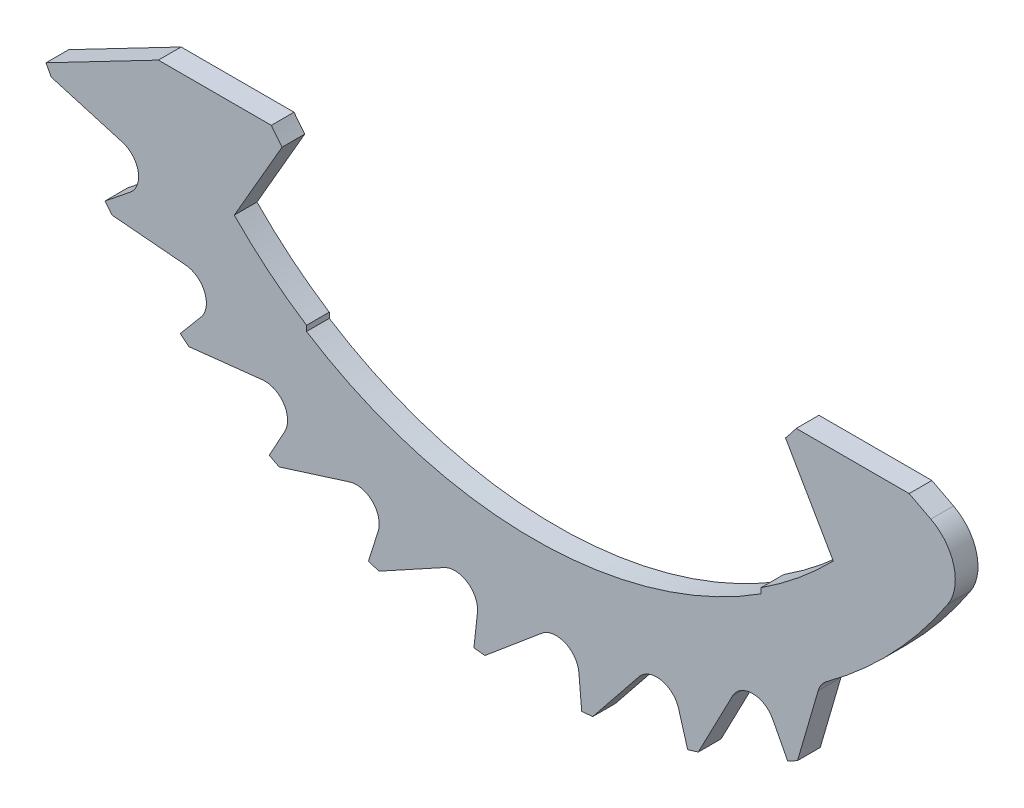
from build123d import *

# Parameters (mm, degrees)
OTHER_10076_5_DEPTH = 0.5
CUT_EXTRUDE1_REACH  = 18.147


# Read off the part's stored shape, not the designer's step: 10076-5
with BuildPart() as part:
    # Other 10076-5 outline → Other 10076-5 (new body)
    with BuildSketch(Plane.XY):
        with BuildLine():
            ThreePointArc((7.573674013, -9.436602245), (7.668819519, -9.359444812), (7.763179028, -9.281328104))
            Line((7.763179028, -9.281328104), (7.919995926, -7.488902759))
            ThreePointArc((7.919995926, -7.488902759), (8.548470738, -6.76266575), (9.110578105, -5.983925684))
            ThreePointArc((9.110578105, -5.983925684), (9.242448569, -5.182849851), (8.736493865, -4.547930843))
            Line((8.736493865, -4.547930843), (8.260223146, -4.3))
            Line((8.260223146, -4.3), (5.774945887, -4.3))
            ThreePointArc((5.774945887, -4.3), (5.659072475, -4.451392897), (5.53923133, -4.5996648))
            Line((5.53923133, -4.5996648), (6.59, -6.419649523))
            ThreePointArc((6.59, -6.419649523), (5.831509763, -7.1157216), (5, -7.722693831))
            Line((5, -7.722693831), (5, -7.841555968))
            ThreePointArc((5, -7.841555968), (0, -9.3), (-5, -7.841555968))
            Line((-5, -7.841555968), (-5, -7.722693831))
            ThreePointArc((-5, -7.722693831), (-5.831509763, -7.1157216), (-6.59, -6.419649523))
            Line((-6.59, -6.419649523), (-5.53923133, -4.5996648))
            ThreePointArc((-5.53923133, -4.5996648), (-5.659072475, -4.451392897), (-5.774945887, -4.3))
            Line((-5.774945887, -4.3), (-8.260223146, -4.3))
            Line((-8.260223146, -4.3), (-10.732831081, -5.58715822))
            ThreePointArc((-10.732831081, -5.58715822), (-10.675718173, -5.6955282), (-10.617511084, -5.803314431))
            Line((-10.617511084, -5.803314431), (-9.055174855, -6.258693914))
            ThreePointArc((-9.055174855, -6.258693914), (-8.704696722, -6.64117368), (-8.882127626, -7.128661083))
            Line((-8.882127626, -7.128661083), (-9.436602245, -7.573674013))
            ThreePointArc((-9.436602245, -7.573674013), (-9.359444812, -7.668819519), (-9.281328104, -7.763179028))
            Line((-9.281328104, -7.763179028), (-7.660171598, -7.905011844))
            ThreePointArc((-7.660171598, -7.905011844), (-7.241809703, -8.211767477), (-7.320727248, -8.724502998))
            Line((-7.320727248, -8.724502998), (-7.777730077, -9.269137762))
            ThreePointArc((-7.777730077, -9.269137762), (-7.683493234, -9.347402405), (-7.588468891, -9.424709008))
            Line((-7.588468891, -9.424709008), (-5.970792243, -9.247544602))
            ThreePointArc((-5.970792243, -9.247544602), (-5.500623999, -9.466787654), (-5.477995427, -9.985067155))
            Line((-5.477995427, -9.985067155), (-5.819964104, -10.608393744))
            ThreePointArc((-5.819964104, -10.608393744), (-5.712269322, -10.666769858), (-5.603989074, -10.724052707))
            Line((-5.603989074, -10.724052707), (-4.05195869, -10.234699407))
            ThreePointArc((-4.05195869, -10.234699407), (-3.548052399, -10.358004491), (-3.424747314, -10.861910782))
            Line((-3.424747314, -10.861910782), (-3.638540174, -11.539975104))
            ThreePointArc((-3.638540174, -11.539975104), (-3.521526102, -11.576219327), (-3.404151099, -11.611277074))
            Line((-3.404151099, -11.611277074), (-1.977410637, -10.828540453))
            ThreePointArc((-1.977410637, -10.828540453), (-1.459131136, -10.851169025), (-1.239888083, -11.321337268))
            Line((-1.239888083, -11.321337268), (-1.317289186, -12.028081692))
            ThreePointArc((-1.317289186, -12.028081692), (-1.195452609, -12.04080118), (-1.073493507, -12.052286575))
            Line((-1.073493507, -12.052286575), (0.173128198, -11.006246762))
            ThreePointArc((0.173128198, -11.006246762), (0.685863719, -10.927329218), (0.992619352, -11.345691113))
            Line((0.992619352, -11.345691113), (1.054584487, -12.053955847))
            ThreePointArc((1.054584487, -12.053955847), (1.176561457, -12.042661796), (1.298417839, -12.030133462))
            Line((1.298417839, -12.030133462), (2.317013814, -10.760989181))
            ThreePointArc((2.317013814, -10.760989181), (2.804501216, -10.583558277), (3.186980982, -10.93403641))
            Line((3.186980982, -10.93403641), (3.38593107, -11.616603238))
            ThreePointArc((3.38593107, -11.616603238), (3.503360927, -11.581729673), (3.620431715, -11.545669067))
            Line((3.620431715, -11.545669067), (4.371857887, -10.10219282))
            ThreePointArc((4.371857887, -10.10219282), (4.815363304, -9.833067127), (5.258868721, -10.10219282))
            Line((5.258868721, -10.10219282), (5.58715822, -10.732831081))
            ThreePointArc((5.58715822, -10.732831081), (5.6955282, -10.675718173), (5.803314431, -10.617511084))
            Line((5.803314431, -10.617511084), (6.258693914, -9.055174855))
            ThreePointArc((6.258693914, -9.055174855), (6.64117368, -8.704696722), (7.128661083, -8.882127626))
            Line((7.128661083, -8.882127626), (7.573674013, -9.436602245))
        make_face()
    extrude(amount=OTHER_10076_5_DEPTH)

    # Sketch1 → Cut-Extrude1 (cut, up to next)
    with BuildSketch(Plane.XY.offset(0.5), mode=Mode.PRIVATE) as cut_extrude1_sk1:
        with BuildLine():
            Line((7.573674013, -9.436602245), (7.128661083, -8.882127626))
            ThreePointArc((7.128661083, -8.882127626), (6.804041546, -8.699374782), (6.443160998, -8.791795969))
            ThreePointArc((6.443160998, -8.791795969), (7.211064546, -8.173771964), (7.919995926, -7.488902759))
            Line((7.919995926, -7.488902759), (7.763179028, -9.281328104))
            ThreePointArc((7.763179028, -9.281328104), (7.668819519, -9.359444812), (7.573674013, -9.436602245))
        make_face()
    cut_extrude1_tool1 = extrude(cut_extrude1_sk1.sketch, amount=-CUT_EXTRUDE1_REACH, mode=Mode.PRIVATE) & part.part
    add(cut_extrude1_tool1.solids().sort_by_distance((7.456757, -8.533041, 0.5))[0], mode=Mode.SUBTRACT)


solid = part.part
